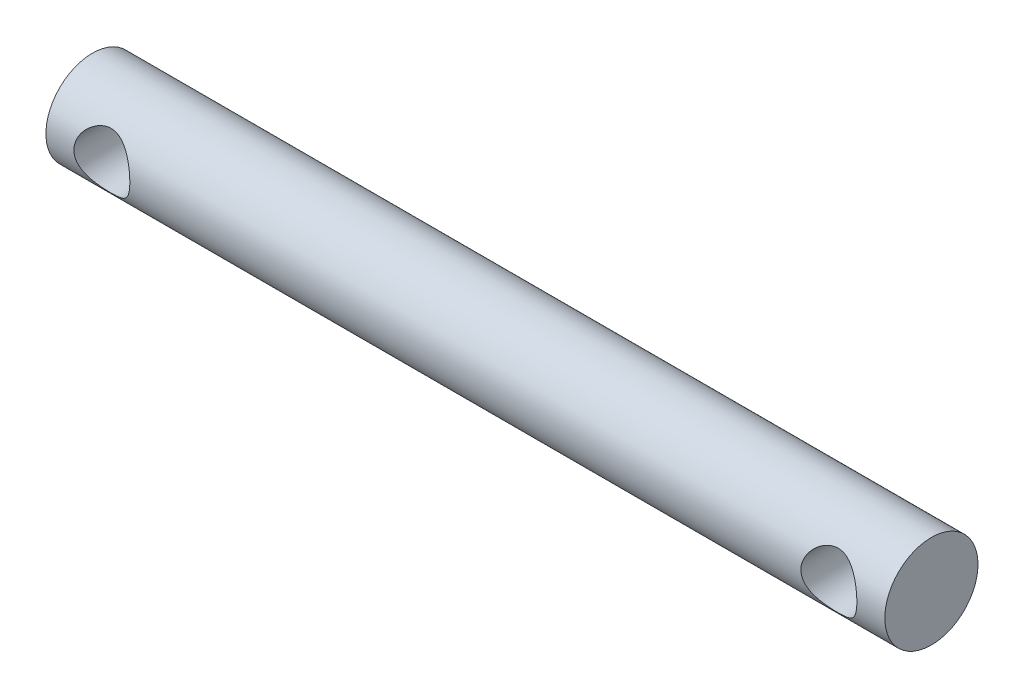
from build123d import *

# Parameters (mm, degrees)
SKETCH1_R           = 2.5
BOSS_EXTRUDE1_DEPTH = 22.5
SKETCH2_R           = 1.5
CUT_EXTRUDE1_DEPTH  = 15


with BuildPart() as part:
    # Sketch1 → Boss-Extrude1 (new, symmetric)
    with BuildSketch(Plane(origin=(0, 0, 0), x_dir=(0, 0, -1), z_dir=(1, 0, 0))):
        Circle(SKETCH1_R)
    extrude(amount=BOSS_EXTRUDE1_DEPTH, both=True)

    # Sketch2 → Cut-Extrude1 (cut, symmetric)
    with BuildSketch(Plane.XY):
        with Locations((-19.5, 0)):
            Circle(SKETCH2_R)
        with Locations((19.5, 0)):
            Circle(SKETCH2_R)
    extrude(amount=CUT_EXTRUDE1_DEPTH, both=True, mode=Mode.SUBTRACT)


solid = part.part
